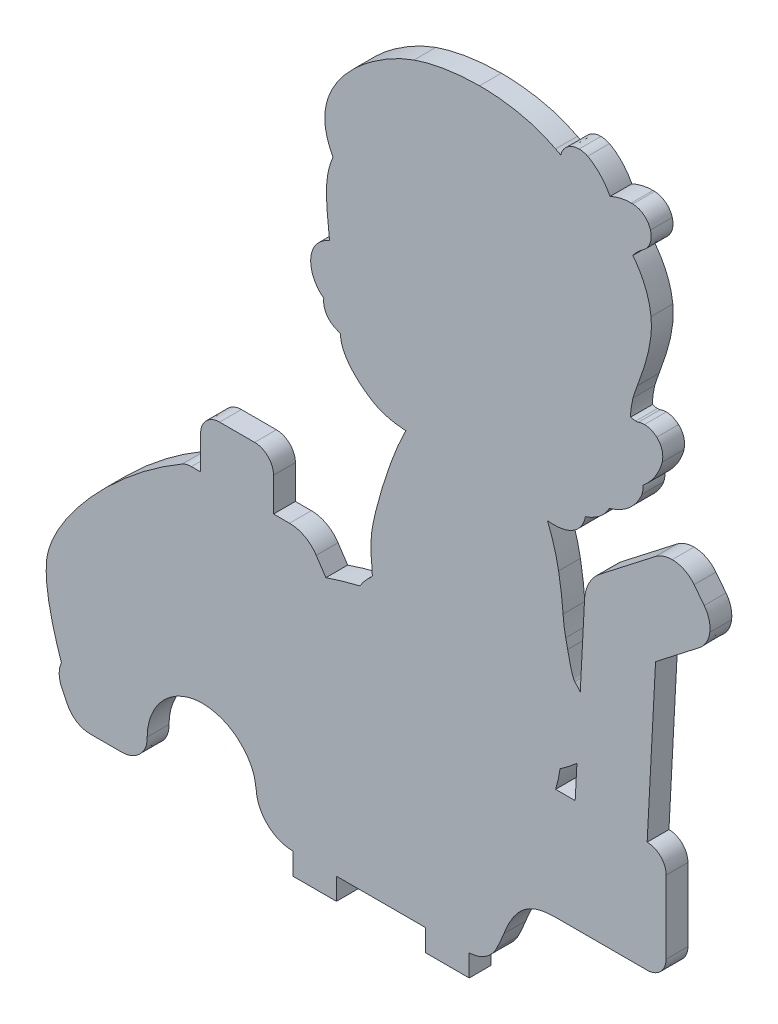
from build123d import *

# Parameters (mm, degrees)
BASE_FLANGE1_DEPTH = 2.3
SKETCH6_W          = 4.6
SKETCH6_H          = 2.3
TAB1_DEPTH         = 2.3


# Sheet-metal steps are written as plain solids
with BuildPart() as part:
    # Model → Base-Flange1 (new body)
    with BuildSketch(Plane.XY):
        with BuildLine():
            Line((263.528664943, -380.056910108), (262.510143798, -378.525904405))
            add(Edge.make_bspline(
                [(262.510143798, -378.525904405), (261.883088229, -377.572347558), (260.829582894, -377.00341697), (259.689662752, -377.00341697)],
                knots=[24, 24, 24, 24, 25, 25, 25, 25], degree=3))
            Line((259.689662752, -377.00341697), (258.009812496, -377.00341697))
            Line((258.009812496, -377.00341697), (258.009812496, -373.459002639))
            add(Edge.make_bspline(
                [(258.009812496, -373.459002639), (258.009812496, -372.352606068), (257.116182677, -371.455701811), (256.013825362, -371.455701811)],
                knots=[27, 27, 27, 27, 28, 28, 28, 28], degree=3))
            Line((256.013825362, -371.455701811), (252.317074613, -371.455701811))
            add(Edge.make_bspline(
                [(252.317074613, -371.455701811), (251.214717299, -371.455701811), (250.321087479, -372.352606068), (250.321087479, -373.459002639)],
                knots=[29, 29, 29, 29, 30, 30, 30, 30], degree=3))
            Line((250.321087479, -373.459002639), (250.321087479, -377.00341697))
            Line((250.321087479, -377.00341697), (249.346768646, -377.00341697))
            add(Edge.make_bspline(
                [(249.346768646, -377.00341697), (248.998896254, -377.00341697), (248.657074524, -377.094672474), (248.355170911, -377.268094614)],
                knots=[32, 32, 32, 32, 33, 33, 33, 33], degree=3))
            add(Edge.make_bspline(
                [(248.355170911, -377.268094614), (241.237360265, -381.357515021), (234.56790765, -388.778433835), (234.082514701, -393.148916305)],
                knots=[33, 33, 33, 33, 34, 34, 34, 34], degree=3))
            add(Edge.make_bspline(
                [(234.082514701, -393.148916305), (233.775189859, -395.916252722), (234.956327591, -399.805718013), (235.642387256, -401.768057795)],
                knots=[34, 34, 34, 34, 35, 35, 35, 35], degree=3))
            add(Edge.make_bspline(
                [(235.642387256, -401.768057795), (235.31364145, -402.491906727), (235.323265655, -403.322009835), (235.681330771, -404.04879329)],
                knots=[35, 35, 35, 35, 36, 36, 36, 36], degree=3))
            Line((235.681330771, -404.04879329), (236.284325826, -405.272570769))
            add(Edge.make_bspline(
                [(236.284325826, -405.272570769), (236.735688883, -406.188630937), (237.649013807, -406.757683797), (238.667859819, -406.757683797)],
                knots=[37, 37, 37, 37, 38, 38, 38, 38], degree=3))
            Line((238.667859819, -406.757683797), (242.023316747, -406.757683797))
            add(Edge.make_bspline(
                [(242.023316747, -406.757683797), (242.839364265, -406.757683797), (243.570714884, -406.387066857), (244.058798521, -405.804854037)],
                knots=[39, 39, 39, 39, 40, 40, 40, 40], degree=3))
            add(Edge.make_bspline(
                [(244.058798521, -405.804854037), (244.447531074, -405.341152616), (244.681952767, -404.856631199), (244.681952767, -404.035261879)],
                knots=[40, 40, 40, 40, 41, 41, 41, 41], degree=3))
            add(Edge.make_bspline(
                [(244.681952767, -404.035261879), (244.721005689, -400.714493453), (247.34328925, -398.041988358), (250.493450097, -398.041988358)],
                knots=[41, 41, 41, 41, 42, 42, 42, 42], degree=3))
            add(Edge.make_bspline(
                [(250.493450097, -398.041988358), (252.901044604, -398.045248939), (255.015567839, -399.500609167), (255.88804065, -401.705576916)],
                knots=[42, 42, 42, 42, 43, 43, 43, 43], degree=3))
            add(Edge.make_bspline(
                [(255.88804065, -401.705576916), (256.026249499, -402.057331764), (256.190411259, -403.165257414)],
                knots=[43, 43, 43, 44, 44, 44], degree=2))
            add(Edge.make_bspline(
                [(256.190411259, -403.165257414), (256.333170308, -405.170188532), (258.006584123, -406.757683797), (260.042996981, -406.757683797)],
                knots=[44, 44, 44, 44, 45, 45, 45, 45], degree=3))
            Line((260.042996981, -406.757683797), (278.538506872, -406.757683797))
            add(Edge.make_bspline(
                [(278.538506872, -406.757683797), (279.792678923, -406.757683797), (280.928233655, -406.067337332), (281.502031226, -404.956009133)],
                knots=[46, 46, 46, 46, 47, 47, 47, 47], degree=3))
            add(Edge.make_bspline(
                [(281.502031226, -404.956009133), (281.780727102, -404.416219986), (282.046814051, -403.817495841), (282.292901332, -403.176465661)],
                knots=[47, 47, 47, 47, 48, 48, 48, 48], degree=3))
            add(Edge.make_bspline(
                [(282.292901332, -403.176465661), (283.760044463, -399.28952732), (285.883034563, -398.965181047), (287.932137565, -398.965181047)],
                knots=[48, 48, 48, 48, 49, 49, 49, 49], degree=3))
            Line((287.932137565, -398.965181047), (297.407980091, -398.965181047))
            add(Edge.make_bspline(
                [(297.407980091, -398.965181047), (298.510337405, -398.965181047), (299.403967225, -398.068276791), (299.403967225, -396.961880219)],
                knots=[50, 50, 50, 50, 51, 51, 51, 51], degree=3))
            Line((299.403967225, -396.961880219), (299.403967225, -389.27705815))
            add(Edge.make_bspline(
                [(299.403967225, -389.27705815), (299.403967225, -388.170661578), (298.510337405, -387.273757322), (297.407980091, -387.273757322)],
                knots=[52, 52, 52, 52, 53, 53, 53, 53], degree=3))
            Line((297.407980091, -387.273757322), (297.403574072, -387.273757322))
            Line((297.403574072, -387.273757322), (298.2919654, -370.341887419))
            Line((298.2919654, -370.341887419), (302.897310186, -366.769228307))
            add(Edge.make_bspline(
                [(302.897310186, -366.769228307), (303.516061324, -366.28923006), (303.910816185, -365.596315888), (304.00892623, -364.818137529)],
                knots=[56, 56, 56, 56, 57, 57, 57, 57], degree=3))
            add(Edge.make_bspline(
                [(304.00892623, -364.818137529), (304.106995666, -364.040244471), (303.896745353, -363.27086968), (303.416936068, -362.651685391)],
                knots=[57, 57, 57, 57, 58, 58, 58, 58], degree=3))
            Line((303.416936068, -362.651685391), (302.356628816, -361.283504941))
            add(Edge.make_bspline(
                [(302.356628816, -361.283504941), (301.798648241, -360.563487191), (300.956834819, -360.150555015), (300.047083441, -360.150555015)],
                knots=[59, 59, 59, 59, 60, 60, 60, 60], degree=3))
            add(Edge.make_bspline(
                [(300.047083441, -360.150555015), (299.403317489, -360.150555015), (298.768160532, -360.36821916), (298.25856494, -360.763483064)],
                knots=[60, 60, 60, 60, 61, 61, 61, 61], degree=3))
            Line((298.25856494, -360.763483064), (292.429281103, -365.285664055))
            add(Edge.make_bspline(
                [(292.429281103, -365.285664055), (291.461540841, -366.036412778), (290.869672504, -367.169342325), (290.805429917, -368.393975707)],
                knots=[62, 62, 62, 62, 63, 63, 63, 63], degree=3))
            Line((290.805429917, -368.393975707), (290.348584717, -377.102049538))
            add(Edge.make_bspline(
                [(290.348584717, -377.102049538), (290.156222432, -376.850984819), (289.960225689, -376.627145948), (289.771964858, -376.438765894)],
                knots=[64, 64, 64, 64, 65, 65, 65, 65], degree=3))
            add(Edge.make_bspline(
                [(289.771964858, -376.438765894), (289.49858869, -376.131089341), (289.211974164, -374.765028268), (289.022312342, -373.861032249)],
                knots=[65, 65, 65, 65, 66, 66, 66, 66], degree=3))
            add(Edge.make_bspline(
                [(289.022312342, -373.861032249), (288.955511421, -373.542595779), (288.88741103, -373.218290263), (288.814417319, -372.892884302)],
                knots=[66, 66, 66, 66, 67, 67, 67, 67], degree=3))
            add(Edge.make_bspline(
                [(288.814417319, -372.892884302), (288.642034397, -372.124487685), (288.598461517, -371.599778724), (288.538137647, -370.873565871)],
                knots=[67, 67, 67, 67, 68, 68, 68, 68], degree=3))
            add(Edge.make_bspline(
                [(288.538137647, -370.873565871), (288.467499227, -370.022961862), (288.379581906, -368.964373556), (288.067851046, -367.171135645)],
                knots=[68, 68, 68, 68, 69, 69, 69, 69], degree=3))
            add(Edge.make_bspline(
                [(288.067851046, -367.171135645), (287.812180168, -365.700287657), (287.365954081, -364.323874241), (286.892743671, -363.160865836)],
                knots=[69, 69, 69, 69, 70, 70, 70, 70], degree=3))
            add(Edge.make_bspline(
                [(286.892743671, -363.160865836), (287.041573685, -363.179125088), (287.175317655, -363.189925762), (287.291843637, -363.195917079)],
                knots=[70, 70, 70, 70, 71, 71, 71, 71], degree=3))
            add(Edge.make_bspline(
                [(287.291843637, -363.195917079), (287.394055137, -363.201134008), (287.491718488, -363.203579444), (287.58501643, -363.203579444)],
                knots=[71, 71, 71, 71, 72, 72, 72, 72], degree=3))
            add(Edge.make_bspline(
                [(287.58501643, -363.203579444), (289.903252016, -363.203579444), (290.74382688, -361.722216084), (290.875032821, -360.846892796)],
                knots=[72, 72, 72, 72, 73, 73, 73, 73], degree=3))
            add(Edge.make_bspline(
                [(290.875032821, -360.846892796), (290.877530241, -360.830263834), (290.879844924, -360.813594115), (290.881956564, -360.796965153)],
                knots=[73, 73, 73, 73, 74, 74, 74, 74], degree=3))
            add(Edge.make_bspline(
                [(290.881956564, -360.796965153), (292.05769337, -360.441724878), (292.874370153, -359.693095532), (293.271114829, -359.026184492)],
                knots=[74, 74, 74, 74, 75, 75, 75, 75], degree=3))
            add(Edge.make_bspline(
                [(293.271114829, -359.026184492), (293.317976994, -358.94738033), (293.359052454, -358.866089976), (293.394259991, -358.783026681)],
                knots=[75, 75, 75, 75, 76, 76, 76, 76], degree=3))
            add(Edge.make_bspline(
                [(293.394259991, -358.783026681), (293.45275648, -358.766723777), (293.511029624, -358.749809514), (293.569038812, -358.732263514)],
                knots=[76, 76, 76, 76, 77, 77, 77, 77], degree=3))
            add(Edge.make_bspline(
                [(293.569038812, -358.732263514), (296.010094692, -357.993904997), (296.770142975, -356.017891155), (296.848760958, -355.79501008)],
                knots=[77, 77, 77, 77, 78, 78, 78, 78], degree=3))
            add(Edge.make_bspline(
                [(296.848760958, -355.79501008), (296.951317629, -355.504288547), (296.989083499, -355.198527585), (296.962200697, -354.901223754)],
                knots=[78, 78, 78, 78, 79, 79, 79, 79], degree=3))
            add(Edge.make_bspline(
                [(296.962200697, -354.901223754), (298.173348082, -353.909823791), (298.791835265, -352.604164977), (298.989578172, -351.779829022)],
                knots=[79, 79, 79, 79, 80, 80, 80, 80], degree=3))
            add(Edge.make_bspline(
                [(298.989578172, -351.779829022), (299.163159044, -351.056245012), (298.976238292, -350.276843935), (298.418785627, -349.786045014)],
                knots=[80, 80, 80, 80, 81, 81, 81, 81], degree=3))
            add(Edge.make_bspline(
                [(298.418785627, -349.786045014), (298.042507617, -349.454749629), (297.588017708, -349.274602541), (297.119477271, -349.274602541)],
                knots=[81, 81, 81, 81, 82, 82, 82, 82], degree=3))
            add(Edge.make_bspline(
                [(297.119477271, -349.274602541), (296.902546866, -349.274602541), (296.68259113, -349.313240423), (296.466005897, -349.393328438)],
                knots=[82, 82, 82, 82, 83, 83, 83, 83], degree=3))
            add(Edge.make_bspline(
                [(296.466005897, -349.393328438), (296.422676668, -349.402009735), (296.324688449, -349.418231124), (296.197157573, -349.418231124)],
                knots=[83, 83, 83, 83, 84, 84, 84, 84], degree=3))
            add(Edge.make_bspline(
                [(296.197157573, -349.418231124), (296.008510962, -349.418231124), (295.833244839, -349.383628211), (295.674283014, -349.315176393)],
                knots=[84, 84, 84, 84, 85, 85, 85, 85], degree=3))
            add(Edge.make_bspline(
                [(295.674283014, -349.315176393), (295.623035134, -349.010984585), (295.702181027, -348.383873009), (295.910380613, -347.446517173)],
                knots=[85, 85, 85, 85, 86, 86, 86, 86], degree=3))
            add(Edge.make_bspline(
                [(295.910380613, -347.446517173), (295.961202103, -347.217705917), (296.173300101, -346.638830558), (296.360423895, -346.128101337)],
                knots=[86, 86, 86, 86, 87, 87, 87, 87], degree=3))
            add(Edge.make_bspline(
                [(296.360423895, -346.128101337), (297.082259615, -344.158017675), (298.070832019, -341.459907463), (297.813029197, -339.073957103)],
                knots=[87, 87, 87, 87, 88, 88, 88, 88], degree=3))
            add(Edge.make_bspline(
                [(297.813029197, -339.073957103), (297.582596478, -336.941537277), (296.623018516, -335.364761171), (295.896797082, -334.448374945)],
                knots=[88, 88, 88, 88, 89, 89, 89, 89], degree=3))
            add(Edge.make_bspline(
                [(295.896797082, -334.448374945), (296.115189392, -334.128002505), (296.518634464, -333.703046937), (296.948190777, -333.407291882)],
                knots=[89, 89, 89, 89, 90, 90, 90, 90], degree=3))
            add(Edge.make_bspline(
                [(296.948190777, -333.407291882), (297.667610294, -332.923706996), (297.989939962, -332.032692164), (297.752685022, -331.196903418)],
                knots=[90, 90, 90, 90, 91, 91, 91, 91], degree=3))
            add(Edge.make_bspline(
                [(297.752685022, -331.196903418), (297.515430081, -330.361094294), (296.76392988, -329.777144656), (295.898604159, -329.746698983)],
                knots=[91, 91, 91, 91, 92, 92, 92, 92], degree=3))
            add(Edge.make_bspline(
                [(295.898604159, -329.746698983), (295.841102576, -329.744681498), (295.78382434, -329.743682946), (295.726870972, -329.743682946)],
                knots=[92, 92, 92, 92, 93, 93, 93, 93], degree=3))
            add(Edge.make_bspline(
                [(295.726870972, -329.743682946), (294.895047233, -329.743682946), (294.146816012, -329.951259669), (293.496694837, -330.255920185)],
                knots=[93, 93, 93, 93, 94, 94, 94, 94], degree=3))
            add(Edge.make_bspline(
                [(293.496694837, -330.255920185), (292.811142778, -328.944412705), (291.831646365, -328.127453813), (291.131678302, -327.771378014)],
                knots=[94, 94, 94, 94, 95, 95, 95, 95], degree=3))
            add(Edge.make_bspline(
                [(291.131678302, -327.771378014), (290.842769398, -327.624407335), (290.534571474, -327.55459015), (290.230820177, -327.55459015)],
                knots=[95, 95, 95, 95, 96, 96, 96, 96], degree=3))
            add(Edge.make_bspline(
                [(290.230820177, -327.55459015), (289.521816731, -327.554569771), (288.836731669, -327.934814625), (288.475641223, -328.601542258)],
                knots=[96, 96, 96, 96, 97, 97, 97, 97], degree=3))
            add(Edge.make_bspline(
                [(288.475641223, -328.601542258), (288.392475093, -328.755095233), (288.331339053, -328.914965584), (288.291238196, -329.077260993)],
                knots=[97, 97, 97, 97, 98, 98, 98, 98], degree=3))
            Line((288.291238196, -329.077260993), (287.748770054, -328.790818971))
            add(Edge.make_bspline(
                [(287.748770054, -328.790818971), (285.001932454, -327.340431129), (281.870938801, -327.035872506), (279.728070859, -327.03581137)],
                knots=[99, 99, 99, 99, 100, 100, 100, 100], degree=3))
            add(Edge.make_bspline(
                [(279.728070859, -327.03581137), (277.292700164, -327.035729855), (274.840030264, -327.425756452), (272.821809997, -328.134056489)],
                knots=[1, 1, 1, 1, 2, 2, 2, 2], degree=3))
            add(Edge.make_bspline(
                [(272.821809997, -328.134056489), (270.603857008, -328.91249977), (268.229642657, -330.401240195), (266.470727725, -332.11648909)],
                knots=[2, 2, 2, 2, 3, 3, 3, 3], degree=3))
            add(Edge.make_bspline(
                [(266.470727725, -332.11648909), (264.129284403, -334.399792291), (263.100793881, -336.812846229), (263.496442128, -339.094763684)],
                knots=[3, 3, 3, 3, 4, 4, 4, 4], degree=3))
            add(Edge.make_bspline(
                [(263.496442128, -339.094763684), (263.621577104, -339.816513617), (263.879359622, -340.547474691), (264.265789749, -341.278415386)],
                knots=[4, 4, 4, 4, 5, 5, 5, 5], degree=3))
            add(Edge.make_bspline(
                [(264.265789749, -341.278415386), (264.05781351, -341.793505634), (263.85194891, -342.429502292), (263.716154213, -343.159790871)],
                knots=[5, 5, 5, 5, 6, 6, 6, 6], degree=3))
            add(Edge.make_bspline(
                [(263.716154213, -343.159790871), (263.447387106, -344.604941406), (263.658530805, -346.801737325), (263.877532242, -348.747387008)],
                knots=[6, 6, 6, 6, 7, 7, 7, 7], degree=3))
            add(Edge.make_bspline(
                [(263.877532242, -348.747387008), (263.892171592, -348.877443424), (263.905450559, -348.994600167), (263.916475757, -349.09598385)],
                knots=[7, 7, 7, 7, 8, 8, 8, 8], degree=3))
            add(Edge.make_bspline(
                [(263.916475757, -349.09598385), (263.307267607, -349.324937757), (262.774545496, -349.732428839), (262.416257034, -350.267286358)],
                knots=[8, 8, 8, 8, 9, 9, 9, 9], degree=3))
            add(Edge.make_bspline(
                [(262.416257034, -350.267286358), (261.852834925, -351.108312411), (261.766277988, -352.173319985), (262.178778747, -353.189174304)],
                knots=[9, 9, 9, 9, 10, 10, 10, 10], degree=3))
            add(Edge.make_bspline(
                [(262.178778747, -353.189174304), (262.429414175, -353.806402245), (262.81838233, -354.302418095), (263.304587448, -354.648875181)],
                knots=[10, 10, 10, 10, 11, 11, 11, 11], degree=3))
            add(Edge.make_bspline(
                [(263.304587448, -354.648875181), (263.276547305, -354.862056028), (263.28261827, -355.080494561), (263.324627725, -355.295815164)],
                knots=[11, 11, 11, 11, 12, 12, 12, 12], degree=3))
            add(Edge.make_bspline(
                [(263.324627725, -355.295815164), (263.430960983, -355.841045405), (263.758143363, -356.317457014), (264.227962966, -356.611235341)],
                knots=[12, 12, 12, 12, 13, 13, 13, 13], degree=3))
            add(Edge.make_bspline(
                [(264.227962966, -356.611235341), (264.347392454, -356.68592302), (264.634839453, -356.8483407), (265.089573013, -357.002668063)],
                knots=[13, 13, 13, 13, 14, 14, 14, 14], degree=3))
            add(Edge.make_bspline(
                [(265.089573013, -357.002668063), (265.075847353, -357.16215122), (265.081106149, -357.324630036), (265.106669176, -357.486680901)],
                knots=[14, 14, 14, 14, 15, 15, 15, 15], degree=3))
            add(Edge.make_bspline(
                [(265.106669176, -357.486680901), (265.325163006, -358.871041983), (266.620633863, -360.391328526), (268.572093819, -361.553481029)],
                knots=[15, 15, 15, 15, 16, 16, 16, 16], degree=3))
            add(Edge.make_bspline(
                [(268.572093819, -361.553481029), (269.409216963, -362.052023829), (270.544934129, -362.34307142), (271.955753323, -362.421732932)],
                knots=[16, 16, 16, 16, 17, 17, 17, 17], degree=3))
            add(Edge.make_bspline(
                [(271.955753323, -362.421732932), (270.315882098, -365.607524134), (268.728903396, -370.920395963), (268.369153029, -373.403776552)],
                knots=[17, 17, 17, 17, 18, 18, 18, 18], degree=3))
            add(Edge.make_bspline(
                [(268.369153029, -373.403776552), (268.194638163, -374.608561148), (268.288991925, -375.616284394), (268.364787619, -376.425968115)],
                knots=[18, 18, 18, 18, 19, 19, 19, 19], degree=3))
            add(Edge.make_bspline(
                [(268.364787619, -376.425968115), (268.400421545, -376.806437134), (268.448522268, -377.320345421), (268.410878224, -377.506972913)],
                knots=[19, 19, 19, 19, 20, 20, 20, 20], degree=3))
            add(Edge.make_bspline(
                [(268.410878224, -377.506972913), (268.409964533, -377.507828816), (268.40898993, -377.508684718), (268.407995023, -377.509581378)],
                knots=[20, 20, 20, 20, 21, 21, 21, 21], degree=3))
            add(Edge.make_bspline(
                [(268.407995023, -377.509581378), (267.801081251, -378.051123087), (267.38559577, -378.556961437), (267.108280582, -379.018985733)],
                knots=[21, 21, 21, 21, 22, 22, 22, 22], degree=3))
            add(Edge.make_bspline(
                [(267.108280582, -379.018985733), (265.586640895, -379.382866547), (264.389686167, -379.755184114), (263.528664943, -380.056910108)],
                knots=[22, 22, 22, 22, 23, 23, 23, 23], degree=3))
        make_face()
        with BuildLine():
            Line((289.99847886, -383.775276423), (289.814948915, -387.273757322))
            Line((289.814948915, -387.273757322), (287.751328387, -387.273757322))
            add(Edge.make_bspline(
                [(287.751328387, -387.273757322), (288.001720165, -386.492603683), (288.140601106, -385.743607522), (288.21759475, -385.16000432)],
                knots=[3, 3, 3, 3, 4, 4, 4, 4], degree=3))
            add(Edge.make_bspline(
                [(288.21759475, -385.16000432), (288.778864611, -384.778231069), (289.421046832, -384.29676556), (289.99847886, -383.775276423)],
                knots=[0, 0, 0, 0, 1, 1, 1, 1], degree=3))
        make_face(mode=Mode.SUBTRACT)
    extrude(amount=-BASE_FLANGE1_DEPTH)

    # Sketch6 → Tab1 (add)
    with BuildSketch(Plane.XY):
        with Locations((262.342996981, -407.907683797)):
            Rectangle(SKETCH6_W, SKETCH6_H)
        with Locations((276.342996981, -407.907683797)):
            Rectangle(SKETCH6_W, SKETCH6_H)
    extrude(amount=-TAB1_DEPTH)


solid = part.part
